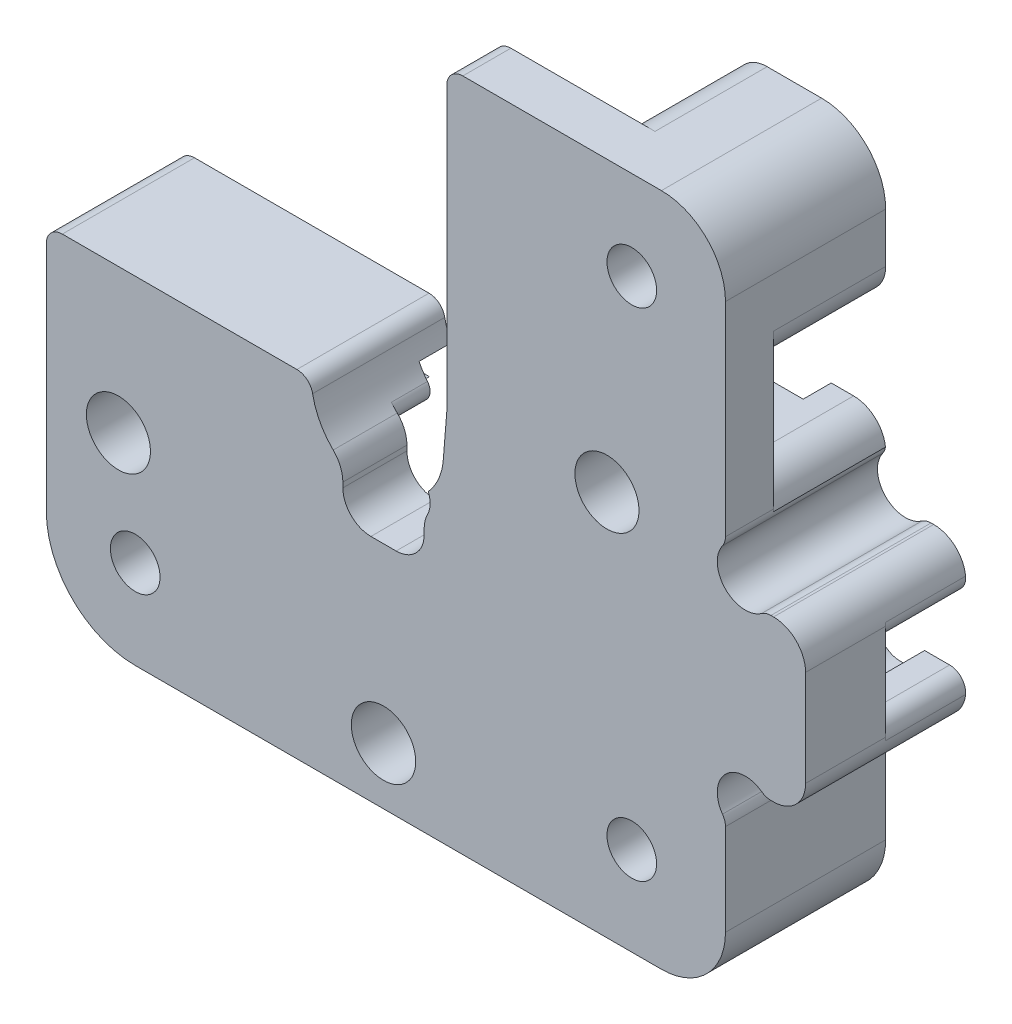
from build123d import *

# Parameters (mm, degrees)
SKETCH1_R                = 4.5
SKETCH1_R_2              = 1.55
BOSS_EXTRUDE1_DEPTH      = 10
BOSS_EXTRUDE5_DEPTH      = 10
SKETCH2_R                = 2.01
CUT_EXTRUDE1_DEPTH       = 36.177052179
SKETCH3_R                = 15
CUT_EXTRUDE3_DEPTH       = 6
CUT_EXTRUDE4_DEPTH       = 6
SKETCH6_W                = 12.05
SKETCH6_H                = 2
CUT_EXTRUDE6_DEPTH       = 4.25
SKETCH24_W               = 3
SKETCH24_H               = 4.2
CUT_EXTRUDE17_DEPTH      = 5
SKETCH13_W               = 21.05
SKETCH13_H               = 2.5
CUT_EXTRUDE10_DEPTH      = 3.75
CUT_EXTRUDE12_DEPTH      = 35.255291562
CUT_EXTRUDE12_DEPTH_BACK = 35.255291562
CUT_EXTRUDE21_DEPTH      = 4.25
SKETCH29_W               = 5
SKETCH29_H               = 19.55
SKETCH29_H_2             = 12.55
CUT_EXTRUDE22_DEPTH      = 36.177052179
SKETCH32_R               = 3.5
SKETCH32_R_2             = 2.01
BOSS_EXTRUDE6_DEPTH      = 0.6
CUT_EXTRUDE24_DEPTH      = 7
FILLET12_R               = 2
FILLET6_R                = 0.75
SKETCH34_W               = 25
SKETCH34_H               = 21.05
CUT_EXTRUDE25_DEPTH      = 36.177052179
SKETCH35_R               = 2
CUT_EXTRUDE27_DEPTH      = 36.177052179
CUT_EXTRUDE29_START      = -1.75
CUT_EXTRUDE29_DEPTH      = 1.75
SKETCH37_W               = 33.1
SKETCH37_H               = 21.25
CUT_EXTRUDE30_DEPTH      = 1.75
SKETCH38_R               = 1.75
CUT_EXTRUDE31_DEPTH      = 36.177052179
CUT_EXTRUDE33_DEPTH      = 7
FILLET13_R               = 4
FILLET7_R                = 2
FILLET3_R                = 2
FILLET15_START           = -1
FILLET15_DEPTH           = 6
FILLET15_START_2         = 4.9438
FILLET15_2_DEPTH         = 6.0562
FILLET14_R               = 1
BOSS_EXTRUDE8_DEPTH      = 8.25
BOSS_EXTRUDE9_START      = -4
BOSS_EXTRUDE9_DEPTH      = 4
BOSS_EXTRUDE10_START     = 1.75
BOSS_EXTRUDE10_DEPTH     = 1.75
CUT_EXTRUDE35_DEPTH      = 1.75
FILLET18_R               = 2


with BuildPart() as part:
    # Sketch1 → Boss-Extrude1 (new body)
    with BuildSketch(Plane.XY):
        with BuildLine():
            Line((-21.05, 15.5), (-21.05, -15.5))
            ThreePointArc((-21.05, -15.5), (-19.424442636, -19.424442636), (-15.5, -21.05))
            Line((-15.5, -21.05), (15.5, -21.05))
            ThreePointArc((15.5, -21.05), (19.424442636, -19.424442636), (21.05, -15.5))
            Line((21.05, -15.5), (21.05, 15.5))
            ThreePointArc((21.05, 15.5), (19.424442636, 19.424442636), (15.5, 21.05))
            Line((15.5, 21.05), (-15.5, 21.05))
            ThreePointArc((-15.5, 21.05), (-19.424442636, 19.424442636), (-21.05, 15.5))
        make_face()
        Circle(SKETCH1_R, mode=Mode.SUBTRACT)
        with Locations((-15.5, -15.5)):
            Circle(SKETCH1_R_2, mode=Mode.SUBTRACT)
        with Locations((15.5, 15.5)):
            Circle(SKETCH1_R_2, mode=Mode.SUBTRACT)
        with Locations((15.5, -15.5)):
            Circle(SKETCH1_R_2, mode=Mode.SUBTRACT)
        with Locations(Location((-15.5, 15.5, 0), (0, 0, 180))):
            Circle(SKETCH1_R_2, mode=Mode.SUBTRACT)
    extrude(amount=BOSS_EXTRUDE1_DEPTH)

    # Sketch23 → Boss-Extrude5 (add)
    with BuildSketch(Plane(origin=(0, 0, 0), x_dir=(-1, 0, 0), z_dir=(0, 0, -1))):
        with BuildLine():
            Line((-21.05, -15.5), (-21.05, 15.5))
            ThreePointArc((-21.05, 15.5), (-19.424442636, 19.424442636), (-15.5, 21.05))
            Line((-15.5, 21.05), (-20.8, 21.05))
            ThreePointArc((-20.8, 21.05), (-24.724442636, 19.424442636), (-26.35, 15.5))
            Line((-26.35, 15.5), (-26.35, -15.5))
            ThreePointArc((-26.35, -15.5), (-24.724442636, -19.424442636), (-20.8, -21.05))
            Line((-20.8, -21.05), (-15.5, -21.05))
            ThreePointArc((-15.5, -21.05), (-19.424442636, -19.424442636), (-21.05, -15.5))
        make_face()
    extrude(amount=-BOSS_EXTRUDE5_DEPTH)

    # Sketch2 → Cut-Extrude1 (cut, through all)
    with BuildSketch(Plane.XY.offset(10)):
        with Locations((0, -17.5)):
            Circle(SKETCH2_R)
    extrude(amount=-CUT_EXTRUDE1_DEPTH, mode=Mode.SUBTRACT)

    # Sketch3 → Cut-Extrude3 (cut)
    with BuildSketch(Plane.XY):
        with Locations((0, -18.5)):
            Circle(SKETCH3_R)
    extrude(amount=CUT_EXTRUDE3_DEPTH, mode=Mode.SUBTRACT)

    # Sketch4 → Cut-Extrude4 (cut)
    with BuildSketch(Plane.XY):
        with BuildLine():
            Line((12.05, -2.621320344), (12.05, -4.378679656))
            ThreePointArc((12.05, -4.378679656), (12.05, -6.5), (14.171320344, -6.5))
            Line((14.171320344, -6.5), (21.228679656, -6.5))
            ThreePointArc((21.228679656, -6.5), (23.35, -6.5), (23.35, -4.378679656))
            Line((23.35, -4.378679656), (23.35, -2.621320344))
            ThreePointArc((23.35, -2.621320344), (23.35, -0.5), (21.228679656, -0.5))
            Line((21.228679656, -0.5), (14.171320344, -0.5))
            ThreePointArc((14.171320344, -0.5), (12.05, -0.5), (12.05, -2.621320344))
        make_face()
    extrude(amount=CUT_EXTRUDE4_DEPTH, mode=Mode.SUBTRACT)

    # Sketch6 → Cut-Extrude6 (cut)
    with BuildSketch(Plane(origin=(0, 0, 0), x_dir=(-1, 0, 0), z_dir=(0, 0, -1))):
        with Locations((-6.025, -3.5)):
            Rectangle(SKETCH6_W, SKETCH6_H)
    extrude(amount=-CUT_EXTRUDE6_DEPTH, mode=Mode.SUBTRACT)

    # Sketch24 → Cut-Extrude17 (cut)
    with BuildSketch(Plane(origin=(0, 0, 0), x_dir=(-1, 0, 0), z_dir=(0, 0, -1))):
        with Locations((-24.85, -3.5)):
            Rectangle(SKETCH24_W, SKETCH24_H)
    extrude(amount=-CUT_EXTRUDE17_DEPTH, mode=Mode.SUBTRACT)

    # Sketch13 → Cut-Extrude10 (cut)
    with BuildSketch(Plane(origin=(0, 0, 0), x_dir=(-1, 0, 0), z_dir=(0, 0, -1))):
        with Locations((10.525, -3.25)):
            Rectangle(SKETCH13_W, SKETCH13_H)
    extrude(amount=-CUT_EXTRUDE10_DEPTH, mode=Mode.SUBTRACT)

    # Sketch15 → Cut-Extrude12 (cut, two sides: drawn at the far end of the back side and taken through both)
    with BuildSketch(Plane(origin=(0, 0, 6), x_dir=(-1, 0, 0), z_dir=(0, 0, -1)).offset(-CUT_EXTRUDE12_DEPTH_BACK)):
        with BuildLine():
            Line((-2.537663696, -3.716216216), (2.537663696, -3.716216216))
            Line((2.537663696, -3.716216216), (2.537663696, -4.966216216))
            ThreePointArc((2.537663696, -4.966216216), (2.025100563, -6.203653083), (0.787663696, -6.716216216))
            Line((0.787663696, -6.716216216), (-0.787663696, -6.716216216))
            ThreePointArc((-0.787663696, -6.716216216), (-2.025100563, -6.203653083), (-2.537663696, -4.966216216))
            Line((-2.537663696, -4.966216216), (-2.537663696, -3.716216216))
        make_face()
    extrude(amount=CUT_EXTRUDE12_DEPTH + CUT_EXTRUDE12_DEPTH_BACK, mode=Mode.SUBTRACT)

    # Sketch28 → Cut-Extrude21 (cut)
    with BuildSketch(Plane(origin=(0, 0, 0), x_dir=(-1, 0, 0), z_dir=(0, 0, -1))):
        with BuildLine():
            Line((-7.958196408, -2.5), (-3.741657387, -2.5))
            ThreePointArc((-3.741657387, -2.5), (-4.133186129, -1.779542756), (-4.387482194, -1))
            ThreePointArc((-4.387482194, -1), (-6.021704735, -2.109772229), (-7.958196408, -2.5))
        make_face()
    extrude(amount=-CUT_EXTRUDE21_DEPTH, mode=Mode.SUBTRACT)

    # Sketch29 → Cut-Extrude22 (cut, through all)
    with BuildSketch(Plane(origin=(0, 0, 0), x_dir=(-1, 0, 0), z_dir=(0, 0, -1))):
        with Locations((-23.85, 11.275)):
            Rectangle(SKETCH29_W, SKETCH29_H)
        with Locations((-23.85, -14.775)):
            Rectangle(SKETCH29_W, SKETCH29_H_2)
    extrude(amount=-CUT_EXTRUDE22_DEPTH, mode=Mode.SUBTRACT)

    # Sketch32 → Boss-Extrude6 (add)
    with BuildSketch(Plane(origin=(0, 0, 6), x_dir=(-1, 0, 0), z_dir=(0, 0, -1))):
        with Locations(Location((0, -17.5, 0), (0, 0, 180))):
            Circle(SKETCH32_R)
        with Locations(Location((0, -17.5, 0), (0, 0, 180))):
            Circle(SKETCH32_R_2, mode=Mode.SUBTRACT)
    extrude(amount=BOSS_EXTRUDE6_DEPTH)

    # Sketch33 → Cut-Extrude24 (cut)
    with BuildSketch(Plane(origin=(0, 0, 0), x_dir=(-1, 0, 0), z_dir=(0, 0, -1))):
        with BuildLine():
            Line((-11.95, 15.5), (-11.95, 21.05))
            Line((-11.95, 21.05), (-5.95, 21.05))
            Line((-5.95, 21.05), (-5.95, 15.5))
            ThreePointArc((-5.95, 15.5), (-8.74713024, 8.74713024), (-15.5, 5.95))
            Line((-15.5, 5.95), (-21.35, 5.95))
            Line((-21.35, 5.95), (-21.35, 11.95))
            Line((-21.35, 11.95), (-15.5, 11.95))
            ThreePointArc((-15.5, 11.95), (-12.989770927, 12.989770927), (-11.95, 15.5))
        make_face()
    extrude(amount=-CUT_EXTRUDE24_DEPTH, mode=Mode.SUBTRACT)

    # Fillet12
    fillet12_edges = [part.edges().sort_by_distance(p)[0] for p in [
        (26.35, 1.5, 5),
        (26.35, -8.5, 5),
        (11.95, 21.05, 3.5),
        (5.95, 21.05, 3.5),
        (21.35, 5.95, 3.5),
        (21.35, 11.95, 3.5),
    ]]
    fillet(fillet12_edges, radius=FILLET12_R)

    # Fillet6
    # the kernel refuses this fillet: 0.75 mm, written as the material it takes off along each edge
    with BuildSketch(Plane(origin=(2.537663696, -3.716216216, 6), x_dir=(0.9766828905522948, -0.2146870543428597, 0), z_dir=(0, 0, -1))) as fillet6_piece_1:
        with BuildLine():
            CenterArc((1.425558271, -0.749193611), FILLET6_R, 92.657162867, 113.757860556)
            ThreePointArc((0.753861914, -1.082846131), (0.416833367, -0.513643581), (0, 0))
            ThreePointArc((0, 0), (0.695394279, -0.016127777), (1.390788557, 0))
        make_face()
    extrude(amount=5.226971393, mode=Mode.SUBTRACT)
    with BuildSketch(Plane(origin=(-2.537663696, -3.716216216, 6), x_dir=(-0.9766828905522948, -0.21468705434286006, 0), z_dir=(0, 0, -1))) as fillet6_piece_2:
        with BuildLine():
            CenterArc((1.425558271, 0.749193611), FILLET6_R, 153.584976577, 113.757860556)
            ThreePointArc((0.753861914, 1.082846131), (0.416833367, 0.513643581), (0, 0))
            ThreePointArc((0, 0), (0.695394279, 0.016127777), (1.390788557, 0))
        make_face()
    extrude(amount=5.726971393, mode=Mode.SUBTRACT)

    # Sketch34 → Cut-Extrude25 (cut, through all)
    with BuildSketch(Plane(origin=(0, 0, 0), x_dir=(-1, 0, 0), z_dir=(0, 0, -1))):
        with Locations((8.55, 10.525)):
            Rectangle(SKETCH34_W, SKETCH34_H)
    extrude(amount=-CUT_EXTRUDE25_DEPTH, mode=Mode.SUBTRACT)

    # Sketch35 → Cut-Extrude27 (cut, through all)
    with BuildSketch(Plane(origin=(0, 0, 0), x_dir=(-1, 0, 0), z_dir=(0, 0, -1))):
        with Locations((16.55, -9)):
            Circle(SKETCH35_R)
        with Locations((-13.95, 3.05)):
            Circle(SKETCH35_R)
    extrude(amount=-CUT_EXTRUDE27_DEPTH, mode=Mode.SUBTRACT)

    # Sketch36 → Cut-Extrude29 (cut)
    with BuildSketch(Plane(origin=(0, 0, 0), x_dir=(-1, 0, 0), z_dir=(0, 0, -1)).offset(CUT_EXTRUDE29_START)):
        with BuildLine():
            Line((-12.05, -2.621320344), (-12.05, 7.5))
            ThreePointArc((-12.05, 7.5), (-11.464213562, 8.914213562), (-10.05, 9.5))
            Line((-10.05, 9.5), (0, 9.5))
            ThreePointArc((0, 9.5), (6.105503576, 7.278243338), (9.355229626, 1.652173913))
            ThreePointArc((9.355229626, 1.652173913), (10.039382479, 0.467738245), (11.324751653, 0))
            Line((11.324751653, 0), (19.05, 0))
            ThreePointArc((19.05, 0), (20.464213562, -0.585786438), (21.05, -2))
            Line((21.05, -2), (21.05, -9.75))
            ThreePointArc((21.05, -9.75), (20.464213562, -11.164213562), (19.05, -11.75))
            Line((19.05, -11.75), (13.997767679, -11.75))
            ThreePointArc((13.997767679, -11.75), (13.490015279, -11.611503047), (13.122907199, -11.234375))
            ThreePointArc((13.122907199, -11.234375), (9.243460442, -6.686514525), (3.896023084, -4.014800515))
            ThreePointArc((3.896023084, -4.014800515), (3.377802295, -3.523133979), (3.506420776, -2.82046332))
            ThreePointArc((3.506420776, -2.82046332), (2.498000201, 3.742992786), (-3.95, 2.155806114))
            ThreePointArc((-3.95, 2.155806114), (-4.482227913, -0.399540902), (-3.506420776, -2.82046332))
            ThreePointArc((-3.506420776, -2.82046332), (-3.377802295, -3.523133979), (-3.896023084, -4.014800515))
            ThreePointArc((-3.896023084, -4.014800515), (-7.356020854, -5.427549686), (-10.359375, -7.651804315))
            ThreePointArc((-10.359375, -7.651804315), (-11.443303318, -7.848000047), (-12.05, -6.92859127))
            Line((-12.05, -6.92859127), (-12.05, -2.621320344))
        make_face()
    extrude(amount=CUT_EXTRUDE29_DEPTH, mode=Mode.SUBTRACT)

    # Sketch37 → Cut-Extrude30 (cut)
    with BuildSketch(Plane(origin=(0, 0, 0), x_dir=(-1, 0, 0), z_dir=(0, 0, -1))):
        with Locations((4.5, -1.125)):
            Rectangle(SKETCH37_W, SKETCH37_H)
    extrude(amount=-CUT_EXTRUDE30_DEPTH, mode=Mode.SUBTRACT)

    # Sketch38 → Cut-Extrude31 (cut, through all)
    with BuildSketch(Plane(origin=(0, 0, 0), x_dir=(-1, 0, 0), z_dir=(0, 0, -1))):
        with Locations((-22.587436867, 2.737436867)):
            Circle(SKETCH38_R)
        with Locations((-22.587436867, -9.737436867)):
            Circle(SKETCH38_R)
    extrude(amount=-CUT_EXTRUDE31_DEPTH, mode=Mode.SUBTRACT)

    # Sketch40 → Cut-Extrude33 (cut)
    with BuildSketch(Plane(origin=(0, 0, 0), x_dir=(-1, 0, 0), z_dir=(0, 0, -1))):
        with BuildLine():
            Line((-3.95, 14.05), (-3.95, 21.05))
            ThreePointArc((-3.95, 21.05), (-5.364213562, 20.464213562), (-5.95, 19.05))
            Line((-5.95, 19.05), (-5.95, 15.5))
            ThreePointArc((-5.95, 15.5), (-6.281021898, 13.007422468), (-7.251139843, 10.687640276))
            ThreePointArc((-7.251139843, 10.687640276), (-5.810187421, 12.574621044), (-3.95, 14.05))
        make_face()
    extrude(amount=-CUT_EXTRUDE33_DEPTH, mode=Mode.SUBTRACT)

    # Fillet13
    # the kernel refuses this fillet: 4 mm, written as the material it takes off along each edge
    with BuildSketch(Plane(origin=(21.35, -21.022680509, 20.000233233), x_dir=(-0.999976677234368, -0.006829713560069607, 0), z_dir=(0, 0, -1))) as fillet13_piece_1:
        with BuildLine():
            CenterArc((3.972774439, 3.999906709), FILLET13_R, 180.391316804, 90)
            Line((-0.02713227, 3.972587855), (-0.427122941, 3.969855969))
            Line((-0.427122941, 3.969855969), (-0.399990671, -0.002731885))
            Line((-0.399990671, -0.002731885), (-0.036920277, -0.398292472))
            ThreePointArc((-0.036920277, -0.398292472), (0.552905642, -0.423553183), (4.002825179, -0.399990671))
            Line((4.002825179, -0.399990671), (4.000093293, 0))
        make_face()
    extrude(amount=30.000466466, mode=Mode.SUBTRACT)
    with BuildSketch(Plane(origin=(21.35, 21.022680509, 20.000233233), x_dir=(0, -1, 0), z_dir=(0, 0, -1))) as fillet13_piece_2:
        with BuildLine():
            CenterArc((3.972680509, 4), FILLET13_R, 180, 90)
            Line((-0.027319491, 4), (-0.427319491, 4))
            ThreePointArc((-0.427319491, 4), (-0.427319491, 0.55), (-0.398031028, -0.03963964))
            Line((-0.398031028, -0.03963964), (0, -0.4))
            Line((0, -0.4), (3.972680509, -0.4))
            Line((3.972680509, -0.4), (3.972680509, 0))
        make_face()
    extrude(amount=30.000466466, mode=Mode.SUBTRACT)

    # Fillet7
    fillet7_edges = [part.edges().sort_by_distance(p)[0] for p in [
        (-2.537663696, -3.716216216, 8),
        (2.537663696, -3.716216216, 8),
    ]]
    fillet(fillet7_edges, radius=FILLET7_R)

    # Fillet3
    # the kernel refuses this fillet: 2 mm, written as the material it takes off along each edge
    with BuildSketch(Plane(origin=(14.781660935, -21.05, 6), x_dir=(1, 0, 0), z_dir=(0, 0, -1))) as fillet3_piece_1:
        with BuildLine():
            CenterArc((2.209439677, -2), FILLET3_R, 90, 91.854010516)
            ThreePointArc((0.210486664, -2.064705882), (0.140995372, -1.028708196), (0, 0))
            Line((0, 0), (2.209439677, 0))
        make_face()
    extrude(amount=11.523599192, mode=Mode.SUBTRACT)
    with BuildSketch(Plane(origin=(-14.781660935, -21.05, 6), x_dir=(-0.9859435440866066, 0.16707880737526726, 0), z_dir=(0, 0, -1))) as fillet3_piece_2:
        with BuildLine():
            CenterArc((2.575373886, 1.928636914), FILLET3_R, 169.646612686, 115.70518839)
            Line((0.607937875, 2.288074726), (0.411194274, 2.324018507))
            ThreePointArc((0.411194274, 2.324018507), (0.15588701, 1.183382499), (-0.188637763, 0.066451444))
            Line((-0.188637763, 0.066451444), (-0.033415761, -0.197188709))
            ThreePointArc((-0.033415761, -0.197188709), (0.674826002, -0.317207943), (3.157812881, -0.192863691))
            Line((3.157812881, -0.192863691), (3.104863882, 0))
        make_face()
    extrude(amount=13.762159704, mode=Mode.SUBTRACT)

    # Fillet15: read off the stored shape, not the designer's step
    # Fillet15 outline → Fillet15 (cut)
    with BuildSketch(Plane.XY.offset(FILLET15_START)):
        with BuildLine():
            ThreePointArc((21.35, -10.974873734), (21.252268718, -10.868730822), (21.163613406, -10.754897801))
            ThreePointArc((21.163613406, -10.754897801), (21.302263988, -11.031028277), (21.35, -11.336304049))
            Line((21.35, -11.336304049), (21.35, -10.974873734))
        make_face()
        with BuildLine():
            Line((23.824873734, -8.5), (24.186304049, -8.5))
            ThreePointArc((24.186304049, -8.5), (23.881028277, -8.452263988), (23.604897801, -8.313613406))
            ThreePointArc((23.604897801, -8.313613406), (23.718730822, -8.402268718), (23.824873734, -8.5))
        make_face()
        with BuildLine():
            Line((26.35, -6.5), (26.35, -5.6))
            Line((26.35, -5.6), (25.344987437, -5.6))
            ThreePointArc((25.344987437, -5.6), (26.086607286, -5.929179607), (26.339974874, -6.7))
            ThreePointArc((26.339974874, -6.7), (26.347492146, -6.60012555), (26.35, -6.5))
        make_face()
        with BuildLine():
            ThreePointArc((26.35, -0.5), (26.347492146, -0.39987445), (26.339974874, -0.3))
            ThreePointArc((26.339974874, -0.3), (26.086607286, -1.070820393), (25.344987437, -1.4))
            Line((25.344987437, -1.4), (26.35, -1.4))
            Line((26.35, -1.4), (26.35, -0.5))
        make_face()
        with BuildLine():
            ThreePointArc((23.824873734, 1.5), (23.718730822, 1.402268718), (23.604897801, 1.313613406))
            ThreePointArc((23.604897801, 1.313613406), (23.881028277, 1.452263988), (24.186304049, 1.5))
            Line((24.186304049, 1.5), (23.824873734, 1.5))
        make_face()
        with BuildLine():
            ThreePointArc((21.349847213, 3.974720928), (21.346043284, 4.075742629), (21.337139537, 4.176443063))
            ThreePointArc((21.337139537, 4.176443063), (21.274717737, 3.955650522), (21.163613406, 3.754897801))
            ThreePointArc((21.163613406, 3.754897801), (21.252198876, 3.868648388), (21.349847213, 3.974720928))
        make_face()
        with BuildLine():
            ThreePointArc((3.95, 2.155806114), (4.001179611, 2.059262422), (4.05, 1.961504525))
            ThreePointArc((4.05, 1.961504525), (3.975320566, 2.173787622), (3.95, 2.397394419))
            Line((3.95, 2.397394419), (3.95, 2.155806114))
        make_face()
        with BuildLine():
            Line((-4.5, 0), (-5.408326913, 0))
            ThreePointArc((-5.408326913, 0), (-4.768724764, -0.231293885), (-4.424994747, -0.818181818))
            ThreePointArc((-4.424994747, -0.818181818), (-4.481209455, -0.410806303), (-4.5, 0))
        make_face()
        with BuildLine():
            ThreePointArc((-21.05, -1), (-20.757106781, -0.292893219), (-20.05, 0))
            Line((-20.05, 0), (-21.05, 0))
            Line((-21.05, 0), (-21.05, -1))
        make_face()
    extrude(amount=FILLET15_DEPTH, mode=Mode.SUBTRACT)

    # Fillet15 2 outline → Fillet15 2 (cut)
    with BuildSketch(Plane.XY.offset(FILLET15_START_2)):
        with BuildLine():
            Line((21.35, 3.974873734), (21.35, 4.336304049))
            ThreePointArc((21.35, 4.336304049), (21.302263988, 4.031028277), (21.163613406, 3.754897801))
            ThreePointArc((21.163613406, 3.754897801), (21.252268718, 3.868730822), (21.35, 3.974873734))
        make_face()
        with BuildLine():
            ThreePointArc((21.35, -10.974873734), (21.252268718, -10.868730822), (21.163613406, -10.754897801))
            ThreePointArc((21.163613406, -10.754897801), (21.302263988, -11.031028277), (21.35, -11.336304049))
            Line((21.35, -11.336304049), (21.35, -10.974873734))
        make_face()
        with BuildLine():
            Line((23.824873734, -8.5), (24.186304049, -8.5))
            ThreePointArc((24.186304049, -8.5), (23.881028277, -8.452263988), (23.604897801, -8.313613406))
            ThreePointArc((23.604897801, -8.313613406), (23.718730822, -8.402268718), (23.824873734, -8.5))
        make_face()
        with BuildLine():
            ThreePointArc((23.824873734, 1.5), (23.718730822, 1.402268718), (23.604897801, 1.313613406))
            ThreePointArc((23.604897801, 1.313613406), (23.881028277, 1.452263988), (24.186304049, 1.5))
            Line((24.186304049, 1.5), (23.824873734, 1.5))
        make_face()
        with BuildLine():
            ThreePointArc((3.95, 2.155806114), (4.001179611, 2.059262422), (4.05, 1.961504525))
            ThreePointArc((4.05, 1.961504525), (3.975320566, 2.173787622), (3.95, 2.397394419))
            Line((3.95, 2.397394419), (3.95, 2.155806114))
        make_face()
        with BuildLine():
            Line((-4.5, 0), (-5.408326913, 0))
            ThreePointArc((-5.408326913, 0), (-4.768724764, -0.231293885), (-4.424994747, -0.818181818))
            ThreePointArc((-4.424994747, -0.818181818), (-4.481209455, -0.410806303), (-4.5, 0))
        make_face()
        with BuildLine():
            ThreePointArc((-21.05, -1), (-20.757106781, -0.292893219), (-20.05, 0))
            Line((-20.05, 0), (-21.05, 0))
            Line((-21.05, 0), (-21.05, -1))
        make_face()
    extrude(amount=FILLET15_2_DEPTH, mode=Mode.SUBTRACT)

    # Fillet14
    fillet14_edges = [part.edges().sort_by_distance(p)[0] for p in [
        (3.95, 21.05, 8.5),
    ]]
    fillet(fillet14_edges, radius=FILLET14_R)

    # Sketch43 → Boss-Extrude8 (add)
    with BuildSketch(Plane(origin=(0, 0, 1.75), x_dir=(-1, 0, 0), z_dir=(0, 0, -1))):
        with BuildLine():
            Line((-7.958196408, -2.5), (-2.795084972, -2.5))
            ThreePointArc((-2.795084972, -2.5), (-3.405912604, -1.569158797), (-3.716517187, -0.5))
            Line((-3.716517187, -0.5), (-3.95, 2.397394419))
            ThreePointArc((-3.95, 2.397394419), (-3.975320566, 2.173787621), (-4.05, 1.961504525))
            ThreePointArc((-4.05, 1.961504525), (-4.471062928, 0.509505933), (-4.387482194, -1))
            ThreePointArc((-4.387482194, -1), (-6.021704735, -2.109772229), (-7.958196408, -2.5))
        make_face()
    extrude(amount=-BOSS_EXTRUDE8_DEPTH)

    # Sketch44 → Boss-Extrude9 (add)
    with BuildSketch(Plane.XY.offset(10).offset(BOSS_EXTRUDE9_START)):
        with BuildLine():
            Line((2.795084972, -2.5), (3.741657387, -2.5))
            ThreePointArc((3.741657387, -2.5), (3.460439649, -2.8766921), (3.141459482, -3.221991981))
            ThreePointArc((3.141459482, -3.221991981), (2.924302047, -3.472013717), (2.751378238, -3.754441718))
            ThreePointArc((2.751378238, -3.754441718), (2.910754521, -3.132012375), (2.795084972, -2.5))
        make_face()
    extrude(amount=BOSS_EXTRUDE9_DEPTH)

    # Sketch45 → Boss-Extrude10 (add)
    with BuildSketch(Plane(origin=(0, 0, 6), x_dir=(-1, 0, 0), z_dir=(0, 0, -1)).offset(BOSS_EXTRUDE10_START)):
        with BuildLine():
            Line((-2.795084972, -2.5), (-3.741657387, -2.5))
            ThreePointArc((-3.741657387, -2.5), (-3.627579558, -2.662830553), (-3.506420776, -2.82046332))
            ThreePointArc((-3.506420776, -2.82046332), (-3.377802295, -3.523133979), (-3.896023084, -4.014800515))
            ThreePointArc((-3.896023084, -4.014800515), (-3.225542277, -3.597917993), (-2.898226041, -2.879447653))
            ThreePointArc((-2.898226041, -2.879447653), (-2.859143104, -2.68632946), (-2.795084972, -2.5))
        make_face()
    extrude(amount=-BOSS_EXTRUDE10_DEPTH)

    # Sketch53 → Cut-Extrude35 (cut)
    with BuildSketch(Plane(origin=(0, 0, 0), x_dir=(-1, 0, 0), z_dir=(0, 0, -1))):
        with BuildLine():
            Line((-17.95, -0.5), (-12.05, -0.5))
            Line((-12.05, -0.5), (-12.05, 2.4255002))
            ThreePointArc((-12.05, 2.4255002), (-15.95, 3.05), (-12.05, 3.6744998))
            Line((-12.05, 3.6744998), (-12.05, 6.594945256))
            ThreePointArc((-12.05, 6.594945256), (-13.745117213, 6.112620898), (-15.5, 5.95))
            Line((-15.5, 5.95), (-17.95, 5.95))
            Line((-17.95, 5.95), (-17.95, -0.5))
        make_face()
    extrude(amount=-CUT_EXTRUDE35_DEPTH, mode=Mode.SUBTRACT)

    # Fillet18
    # the kernel refuses this fillet: 2 mm, written as the material it takes off along each edge
    with BuildSketch(Plane(origin=(-21.05, -2, -2.580127019), x_dir=(1, 0, 0), z_dir=(0, 0, 1))) as fillet18_piece_1:
        with BuildLine():
            CenterArc((1.732050808, 2), FILLET18_R, 210, 60)
            Line((0, 1), (-0.034641016, 0.98))
            ThreePointArc((-0.034641016, 0.98), (-0.04, 0.5), (-0.04, 0))
            Line((-0.04, 0), (0, -0.04))
            Line((0, -0.04), (1.732050808, -0.04))
            Line((1.732050808, -0.04), (1.732050808, 0))
        make_face()
    extrude(amount=6.330127019, mode=Mode.SUBTRACT)
    with BuildSketch(Plane(origin=(-21.05, -4.5, -3.25), x_dir=(1, 0, 0), z_dir=(0, 0, 1))) as fillet18_piece_2:
        with BuildLine():
            CenterArc((FILLET18_R, -FILLET18_R), FILLET18_R, 90, 90)
            Line((0, -FILLET18_R), (-FILLET18_R * 0.02, -FILLET18_R))
            Line((-FILLET18_R * 0.02, -FILLET18_R), (-FILLET18_R * 0.02, FILLET18_R * 0.02))
            Line((-FILLET18_R * 0.02, FILLET18_R * 0.02), (FILLET18_R, FILLET18_R * 0.02))
            Line((FILLET18_R, FILLET18_R * 0.02), (FILLET18_R, 0))
        make_face()
    extrude(amount=7, mode=Mode.SUBTRACT)


solid = part.part
